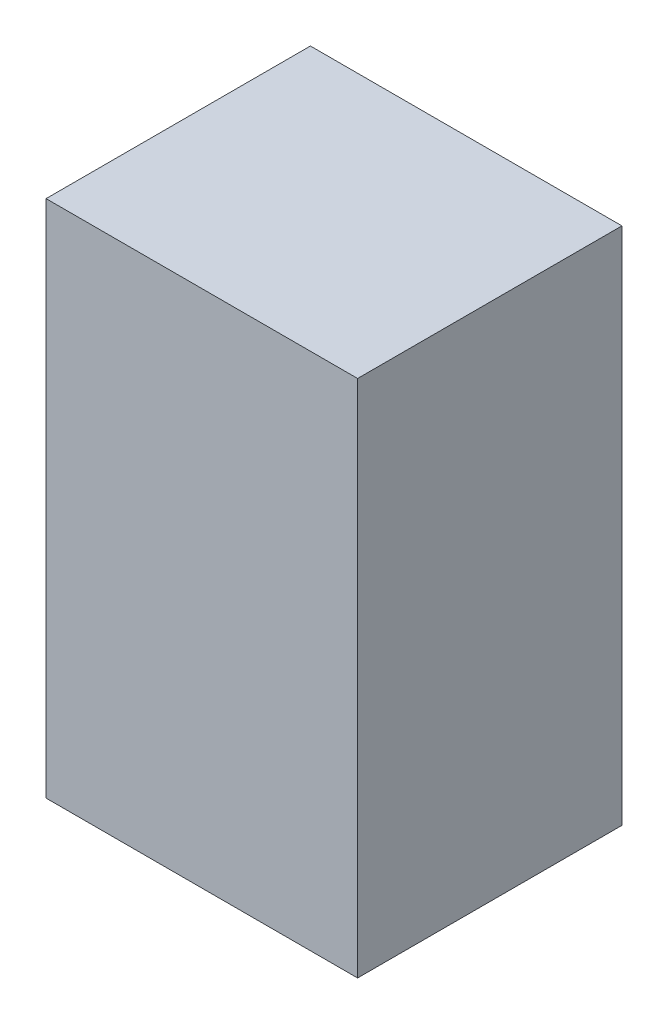
from build123d import *

# Parameters (mm, degrees)
SKETCH1_W           = 838.2
SKETCH1_H           = 711.2
BOSS_EXTRUDE1_DEPTH = 1397
SHELL1_T            = -2.54


with BuildPart() as part:
    # Sketch1 → Boss-Extrude1 (new body)
    with BuildSketch(Plane(origin=(0, 0, 0), x_dir=(1, 0, 0), z_dir=(0, 1, 0))):
        with Locations((419.1, 355.6)):
            Rectangle(SKETCH1_W, SKETCH1_H)
    extrude(amount=BOSS_EXTRUDE1_DEPTH)

    # Shell1
    shell1_openings = [part.faces().sort_by_distance(p)[0] for p in [
        (419.1, 0, -355.6),
    ]]
    offset(amount=SHELL1_T, openings=shell1_openings, kind=Kind.INTERSECTION)


solid = part.part
